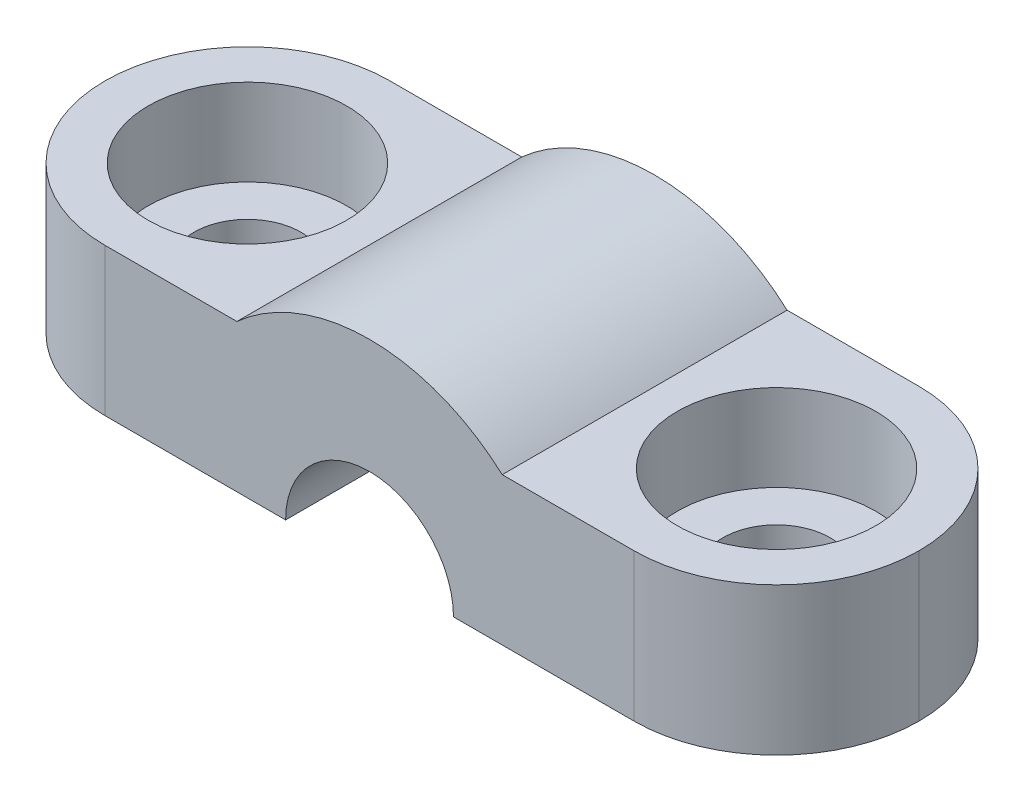
from build123d import *

# Parameters (mm, degrees)
SKETCH1_W           = 40
SKETCH1_H           = 14
BOSS_EXTRUDE1_DEPTH = 7.25
FILLET1_R           = 7
SKETCH2_R           = 2.625
CUT_EXTRUDE1_DEPTH  = 23.395591084
SKETCH3_R           = 4.875
CUT_EXTRUDE2_DEPTH  = 4.25
BOSS_EXTRUDE2_DEPTH = 14
SKETCH5_R           = 4.125
CUT_EXTRUDE3_DEPTH  = 27.288067635


with BuildPart() as part:
    # Sketch1 → Boss-Extrude1 (new body)
    with BuildSketch(Plane(origin=(0, 0, 0), x_dir=(1, 0, 0), z_dir=(0, 1, 0))):
        Rectangle(SKETCH1_W, SKETCH1_H)
    extrude(amount=BOSS_EXTRUDE1_DEPTH)

    # Fillet1
    fillet1_edges = [part.edges().sort_by_distance(p)[0] for p in [
        (-20, 3.625, 7),
        (20, 3.625, 7),
        (20, 3.625, -7),
        (-20, 3.625, -7),
    ]]
    fillet(fillet1_edges, radius=FILLET1_R - 0.0001)  # a hair under: the kernel refuses the full size

    # Sketch2 → Cut-Extrude1 (cut, through all)
    with BuildSketch(Plane(origin=(0, 7.25, 0), x_dir=(1, 0, 0), z_dir=(0, 1, 0))):
        with Locations(Location((-13, 0, 0), (0, 0, 270))):
            Circle(SKETCH2_R)
        with Locations(Location((13, 0, 0), (0, 0, 270))):
            Circle(SKETCH2_R)
    extrude(amount=-CUT_EXTRUDE1_DEPTH, mode=Mode.SUBTRACT)

    # Sketch3 → Cut-Extrude2 (cut)
    with BuildSketch(Plane(origin=(0, 7.25, 0), x_dir=(1, 0, 0), z_dir=(0, 1, 0))):
        with Locations(Location((-13, 0, 0), (0, 0, 270))):
            Circle(SKETCH3_R)
        with Locations(Location((13, 0, 0), (0, 0, 90))):
            Circle(SKETCH3_R)
    extrude(amount=-CUT_EXTRUDE2_DEPTH, mode=Mode.SUBTRACT)

    # Sketch4 → Boss-Extrude2 (add)
    with BuildSketch(Plane.XY.offset(7)):
        with BuildLine():
            Line((6.519202405, 7.25), (-6.519202405, 7.25))
            ThreePointArc((-6.519202405, 7.25), (0, 9.75), (6.519202405, 7.25))
        make_face()
    extrude(amount=-BOSS_EXTRUDE2_DEPTH)

    # Sketch5 → Cut-Extrude3 (cut, through all)
    with BuildSketch(Plane.XY.offset(7)):
        Circle(SKETCH5_R)
    extrude(amount=-CUT_EXTRUDE3_DEPTH, mode=Mode.SUBTRACT)


solid = part.part
